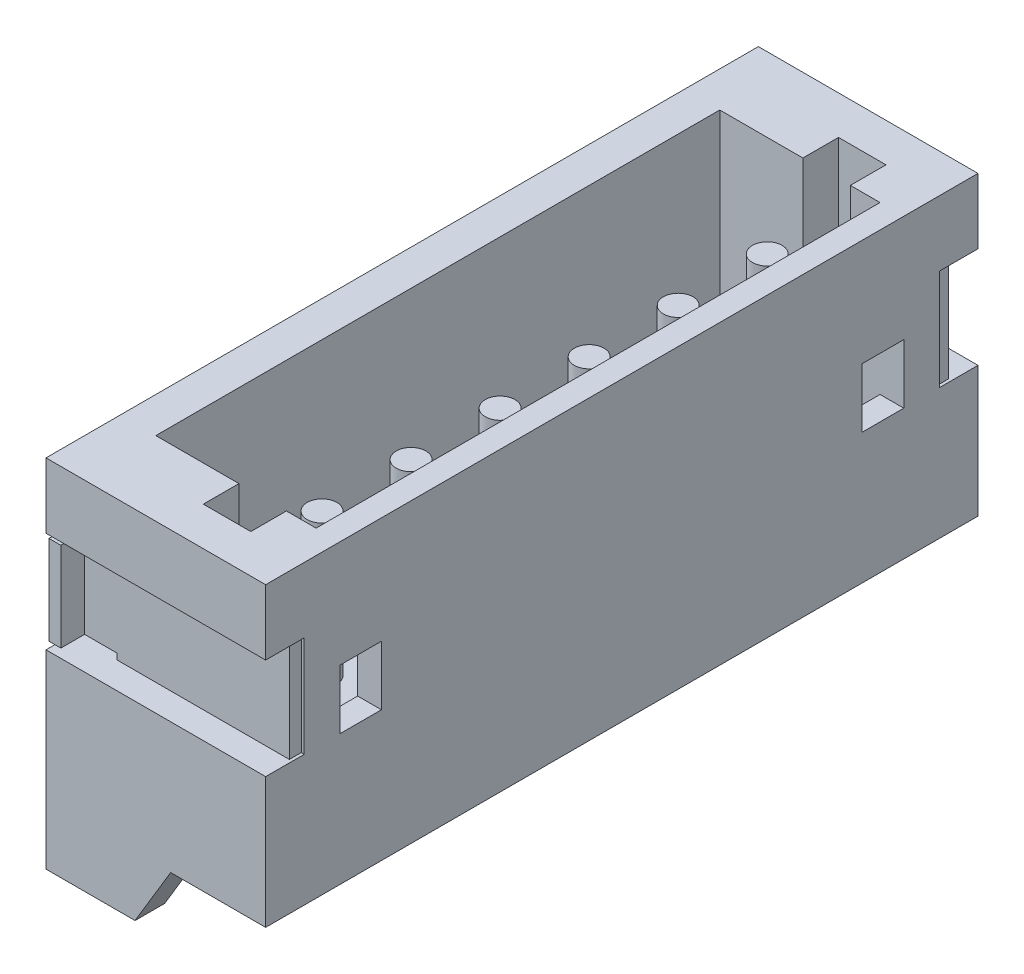
from build123d import *

# Parameters (mm, degrees)
BOSS_EXTRUDE1_START       = -0.6
BOSS_EXTRUDE1_DEPTH       = 3.3
BOSS_EXTRUDE1_2_OUTLINE_W = 9.5
BOSS_EXTRUDE1_2_OUTLINE_H = 2.8
BOSS_EXTRUDE1_2_DEPTH     = 0.6
BOSS_EXTRUDE1_3_OUTLINE_R = 0.25
BOSS_EXTRUDE1_3_ANGLE     = 48.590678
SKETCH2_W                 = 12
SKETCH2_H                 = 5
SKETCH2_W_2               = 0.7
SKETCH2_H_2               = 1
BOSS_EXTRUDE2_DEPTH       = 0.4
SKETCH3_W                 = 2.7
SKETCH3_H                 = 9.5
CUT_EXTRUDE1_DEPTH        = 0.6
SKETCH4_W                 = 0.45
SKETCH4_H                 = 1.7
CUT_EXTRUDE2_DEPTH        = 15.612665805
CUT_EXTRUDE3_REACH        = 50.095
SKETCH6_W                 = 0.05
SKETCH6_H                 = 1.7
SKETCH7_W                 = 0.45
SKETCH7_H                 = 1.7
CUT_EXTRUDE4_DEPTH        = 15.612665805
CUT_EXTRUDE5_REACH        = 50.095
SKETCH9_W                 = 0.05
SKETCH9_H                 = 1.7
CUT_EXTRUDE6_REACH        = 50.095
SKETCH11_W                = 0.75
SKETCH11_H                = 0.1
SKETCH12_W                = 0.2
SKETCH12_H                = 1.5
BOSS_EXTRUDE3_DEPTH       = 0.4
CUT_EXTRUDE7_REACH        = 50.095
SKETCH14_W                = 0.75
SKETCH14_H                = 0.1
CUT_EXTRUDE8_REACH        = 50.095
SKETCH16_W                = 0.75
SKETCH16_H                = 0.1
SKETCH17_W                = 0.2
SKETCH17_H                = 1.5
BOSS_EXTRUDE4_DEPTH       = 0.4
CUT_EXTRUDE9_REACH        = 50.095
SKETCH19_W                = 0.75
SKETCH19_H                = 0.1
BOSS_EXTRUDE5_DEPTH       = 9.5
SKETCH21_W                = 0.8
SKETCH21_H                = 0.6
CUT_EXTRUDE10_DEPTH       = 1.8
SKETCH22_W                = 0.8
SKETCH22_H                = 0.6
CUT_EXTRUDE11_DEPTH       = 1.8
SKETCH23_R                = 0.25
BOSS_EXTRUDE6_DEPTH       = 1.35
SKETCH24_R                = 0.25
BOSS_EXTRUDE7_DEPTH       = 1.35
SKETCH25_R                = 0.25
BOSS_EXTRUDE8_DEPTH       = 1.35
SKETCH26_R                = 0.25
BOSS_EXTRUDE9_DEPTH       = 1.35
SKETCH27_R                = 0.25
BOSS_EXTRUDE10_DEPTH      = 1.35
BOSS_EXTRUDE11_DEPTH      = 0.5
BOSS_EXTRUDE12_DEPTH      = 0.5
SKETCH30_R                = 0.25
BOSS_EXTRUDE13_DEPTH      = 1.35
SKETCH31_W                = 0.25
SKETCH31_H                = 2.4
SKETCH32_W                = 0.25
SKETCH32_H                = 2.4
SKETCH33_W                = 0.25
SKETCH33_H                = 2.4
SKETCH34_W                = 0.25
SKETCH34_H                = 2.4
SKETCH35_W                = 0.25
SKETCH35_H                = 2.4
SKETCH36_W                = 0.25
SKETCH36_H                = 2.4


with BuildPart() as part:
    # Boss-Extrude1: read off the stored shape, not the designer's step
    # Boss-Extrude1 outline → Boss-Extrude1 (new body)
    with BuildSketch(Plane(origin=(41.85, 0, 0), x_dir=(0, 0, -1), z_dir=(1, 0, 0)).offset(BOSS_EXTRUDE1_START)):
        Polygon((-4.75, 12.8), (-6, 12.8), (-6, 7.8), (6, 7.8), (6, 12.8), (4.75, 12.8), (4.75, 10), (-4.75, 10), align=None)
    extrude(amount=BOSS_EXTRUDE1_DEPTH)

    # Boss-Extrude1 2 outline → Boss-Extrude1 2 (add)
    with BuildSketch(Plane(origin=(41.85, 0, 0), x_dir=(0, 0, -1), z_dir=(1, 0, 0)).offset(BOSS_EXTRUDE1_START)):
        with Locations((0, 11.4)):
            Rectangle(BOSS_EXTRUDE1_2_OUTLINE_W, BOSS_EXTRUDE1_2_OUTLINE_H)
    extrude(amount=BOSS_EXTRUDE1_2_DEPTH)

    # Boss-Extrude1 3 outline → Boss-Extrude1 3 (revolve)
    with BuildSketch(Plane(origin=(41.95, 7.65, 0), x_dir=(-0.6614338946121362, 0.7500034686974597, 0), z_dir=(0.7500034686974597, 0.6614338946121362, 0))):
        with Locations((0.45, 2.25)):
            Circle(BOSS_EXTRUDE1_3_OUTLINE_R)
        with Locations((0.45, -2.25)):
            Circle(BOSS_EXTRUDE1_3_OUTLINE_R)
        with Locations((0.45, -0.75)):
            Circle(BOSS_EXTRUDE1_3_OUTLINE_R)
        with Locations((0.45, 0.75)):
            Circle(BOSS_EXTRUDE1_3_OUTLINE_R)
        with Locations((0.45, 3.75)):
            Circle(BOSS_EXTRUDE1_3_OUTLINE_R)
        with Locations((0.45, -3.75)):
            Circle(BOSS_EXTRUDE1_3_OUTLINE_R)
    revolve(axis=Axis((41.95, 7.65, 0), (0, 0, 1)), revolution_arc=BOSS_EXTRUDE1_3_ANGLE)

    # Sketch2 → Boss-Extrude2 (add)
    with BuildSketch(Plane(origin=(44.55, 0, 0), x_dir=(0, 0, -1), z_dir=(1, 0, 0))):
        with Locations((0, 10.3)):
            Rectangle(SKETCH2_W, SKETCH2_H)
        with Locations((4.4, 10.5)):
            Rectangle(SKETCH2_W_2, SKETCH2_H_2, mode=Mode.SUBTRACT)
        with Locations((-4.4, 10.5)):
            Rectangle(SKETCH2_W_2, SKETCH2_H_2, mode=Mode.SUBTRACT)
    extrude(amount=BOSS_EXTRUDE2_DEPTH)

    # Sketch3 → Cut-Extrude1 (cut)
    with BuildSketch(Plane(origin=(0, 10, 0), x_dir=(-1, 0, 0), z_dir=(0, 1, 0))):
        with Locations((-43.2, 0)):
            Rectangle(SKETCH3_W, SKETCH3_H)
    extrude(amount=-CUT_EXTRUDE1_DEPTH, mode=Mode.SUBTRACT)

    # Sketch4 → Cut-Extrude2 (cut, through all)
    with BuildSketch(Plane(origin=(44.95, 0, 0), x_dir=(0, 0, -1), z_dir=(1, 0, 0))):
        with Locations((-5.775, 10.85)):
            Rectangle(SKETCH4_W, SKETCH4_H)
    extrude(amount=-CUT_EXTRUDE2_DEPTH, mode=Mode.SUBTRACT)

    # Sketch6 → Cut-Extrude3 (cut, up to next)
    with BuildSketch(Plane(origin=(0, 0, 5.35), x_dir=(-1, 0, 0), z_dir=(0, 0, -1)), mode=Mode.PRIVATE) as cut_extrude3_sk1:
        with Locations((-44.925, 10.85)):
            Rectangle(SKETCH6_W, SKETCH6_H)
    cut_extrude3_tool1 = extrude(cut_extrude3_sk1.sketch, amount=-CUT_EXTRUDE3_REACH, mode=Mode.PRIVATE) & part.part
    add(cut_extrude3_tool1.solids().sort_by_distance((44.925, 10.85, 5.35))[0], mode=Mode.SUBTRACT)

    # Sketch7 → Cut-Extrude4 (cut, through all)
    with BuildSketch(Plane(origin=(44.95, 0, 0), x_dir=(0, 0, -1), z_dir=(1, 0, 0))):
        with Locations((5.775, 10.85)):
            Rectangle(SKETCH7_W, SKETCH7_H)
    extrude(amount=-CUT_EXTRUDE4_DEPTH, mode=Mode.SUBTRACT)

    # Sketch9 → Cut-Extrude5 (cut, up to next)
    with BuildSketch(Plane.XY.offset(-5.35), mode=Mode.PRIVATE) as cut_extrude5_sk1:
        with Locations((44.925, 10.85)):
            Rectangle(SKETCH9_W, SKETCH9_H)
    cut_extrude5_tool1 = extrude(cut_extrude5_sk1.sketch, amount=-CUT_EXTRUDE5_REACH, mode=Mode.PRIVATE) & part.part
    add(cut_extrude5_tool1.solids().sort_by_distance((44.925, 10.85, -5.35))[0], mode=Mode.SUBTRACT)

    # Sketch11 → Cut-Extrude6 (cut, up to next)
    with BuildSketch(Plane.XY.offset(-5.35), mode=Mode.PRIVATE) as cut_extrude6_sk1:
        with Locations((41.625, 10.05)):
            Rectangle(SKETCH11_W, SKETCH11_H)
    cut_extrude6_tool1 = extrude(cut_extrude6_sk1.sketch, amount=-CUT_EXTRUDE6_REACH, mode=Mode.PRIVATE) & part.part
    add(cut_extrude6_tool1.solids().sort_by_distance((41.625, 10.05, -5.35))[0], mode=Mode.SUBTRACT)

    # Sketch12 → Boss-Extrude3 (add)
    with BuildSketch(Plane(origin=(0, 0, -5.55), x_dir=(-1, 0, 0), z_dir=(0, 0, -1))):
        with Locations((-41.35, 10.85)):
            Rectangle(SKETCH12_W, SKETCH12_H)
    extrude(amount=BOSS_EXTRUDE3_DEPTH)

    # Sketch14 → Cut-Extrude7 (cut, up to next)
    with BuildSketch(Plane.XY.offset(-5.35), mode=Mode.PRIVATE) as cut_extrude7_sk1:
        with Locations((41.625, 11.65)):
            Rectangle(SKETCH14_W, SKETCH14_H)
    cut_extrude7_tool1 = extrude(cut_extrude7_sk1.sketch, amount=-CUT_EXTRUDE7_REACH, mode=Mode.PRIVATE) & part.part
    add(cut_extrude7_tool1.solids().sort_by_distance((41.625, 11.65, -5.35))[0], mode=Mode.SUBTRACT)

    # Sketch16 → Cut-Extrude8 (cut, up to next)
    with BuildSketch(Plane(origin=(0, 0, 5.35), x_dir=(-1, 0, 0), z_dir=(0, 0, -1)), mode=Mode.PRIVATE) as cut_extrude8_sk1:
        with Locations((-41.625, 11.65)):
            Rectangle(SKETCH16_W, SKETCH16_H)
    cut_extrude8_tool1 = extrude(cut_extrude8_sk1.sketch, amount=-CUT_EXTRUDE8_REACH, mode=Mode.PRIVATE) & part.part
    add(cut_extrude8_tool1.solids().sort_by_distance((41.625, 11.65, 5.35))[0], mode=Mode.SUBTRACT)

    # Sketch17 → Boss-Extrude4 (add)
    with BuildSketch(Plane.XY.offset(5.55)):
        with Locations((41.35, 10.85)):
            Rectangle(SKETCH17_W, SKETCH17_H)
    extrude(amount=BOSS_EXTRUDE4_DEPTH)

    # Sketch19 → Cut-Extrude9 (cut, up to next)
    with BuildSketch(Plane(origin=(0, 0, 5.35), x_dir=(-1, 0, 0), z_dir=(0, 0, -1)), mode=Mode.PRIVATE) as cut_extrude9_sk1:
        with Locations((-41.625, 10.05)):
            Rectangle(SKETCH19_W, SKETCH19_H)
    cut_extrude9_tool1 = extrude(cut_extrude9_sk1.sketch, amount=-CUT_EXTRUDE9_REACH, mode=Mode.PRIVATE) & part.part
    add(cut_extrude9_tool1.solids().sort_by_distance((41.625, 10.05, 5.35))[0], mode=Mode.SUBTRACT)

    # Sketch20 → Boss-Extrude5 (add)
    with BuildSketch(Plane(origin=(0, 0, 4.75), x_dir=(-1, 0, 0), z_dir=(0, 0, -1))):
        Polygon((-42.9, 9.4), (-44.55, 9.4), (-44.55, 9.7), (-43.2, 9.7), align=None)
    extrude(amount=BOSS_EXTRUDE5_DEPTH)

    # Sketch21 → Cut-Extrude10 (cut)
    with BuildSketch(Plane(origin=(0, 12.8, 0), x_dir=(-1, 0, 0), z_dir=(0, 1, 0))):
        with Locations((-43.65, -5.05)):
            Rectangle(SKETCH21_W, SKETCH21_H)
    extrude(amount=-CUT_EXTRUDE10_DEPTH, mode=Mode.SUBTRACT)

    # Sketch22 → Cut-Extrude11 (cut)
    with BuildSketch(Plane(origin=(0, 12.8, 0), x_dir=(-1, 0, 0), z_dir=(0, 1, 0))):
        with Locations((-43.65, 5.05)):
            Rectangle(SKETCH22_W, SKETCH22_H)
    extrude(amount=-CUT_EXTRUDE11_DEPTH, mode=Mode.SUBTRACT)

    # Sketch23 → Boss-Extrude6 (add)
    with BuildSketch(Plane.XZ.offset(-7.65)):
        with Locations(Location((41.5, 2.25, 0), (0, 0, 90))):
            Circle(SKETCH23_R)
    extrude(amount=BOSS_EXTRUDE6_DEPTH)

    # Sketch24 → Boss-Extrude7 (add)
    with BuildSketch(Plane.XZ.offset(-7.65)):
        with Locations(Location((41.5, -0.75, 0), (0, 0, 90))):
            Circle(SKETCH24_R)
    extrude(amount=BOSS_EXTRUDE7_DEPTH)

    # Sketch25 → Boss-Extrude8 (add)
    with BuildSketch(Plane.XZ.offset(-7.65)):
        with Locations(Location((41.5, -3.75, 0), (0, 0, 90))):
            Circle(SKETCH25_R)
    extrude(amount=BOSS_EXTRUDE8_DEPTH)

    # Sketch26 → Boss-Extrude9 (add)
    with BuildSketch(Plane.XZ.offset(-7.65)):
        with Locations(Location((41.5, -2.25, 0), (0, 0, 90))):
            Circle(SKETCH26_R)
    extrude(amount=BOSS_EXTRUDE9_DEPTH)

    # Sketch27 → Boss-Extrude10 (add)
    with BuildSketch(Plane.XZ.offset(-7.65)):
        with Locations(Location((41.5, 0.75, 0), (0, 0, 90))):
            Circle(SKETCH27_R)
    extrude(amount=BOSS_EXTRUDE10_DEPTH)

    # Sketch28 → Boss-Extrude11 (add)
    with BuildSketch(Plane.XY.offset(6)):
        Polygon((43.35, 7.8), (41.25, 7.8), (41.25, 6.8), (42.75, 6.8), align=None)
    extrude(amount=-BOSS_EXTRUDE11_DEPTH)

    # Sketch29 → Boss-Extrude12 (add)
    with BuildSketch(Plane(origin=(0, 0, -6), x_dir=(-1, 0, 0), z_dir=(0, 0, -1))):
        Polygon((-41.25, 6.8), (-41.25, 7.8), (-43.35, 7.8), (-42.75, 6.8), align=None)
    extrude(amount=-BOSS_EXTRUDE12_DEPTH)

    # Sketch30 → Boss-Extrude13 (add)
    with BuildSketch(Plane.XZ.offset(-7.65)):
        with Locations(Location((41.5, 3.75, 0), (0, 0, 90))):
            Circle(SKETCH30_R)
    extrude(amount=BOSS_EXTRUDE13_DEPTH)

    # Sketch31 → Revolve1 (revolve)
    with BuildSketch(Plane.XY.offset(3.75)):
        with Locations((43.775, 10.9)):
            Rectangle(SKETCH31_W, SKETCH31_H)
    revolve(axis=Axis((43.65, 12.1, 3.75), (0, -1, 0)))

    # Sketch32 → Revolve2 (revolve)
    with BuildSketch(Plane.XY.offset(0.75)):
        with Locations((43.775, 10.9)):
            Rectangle(SKETCH32_W, SKETCH32_H)
    revolve(axis=Axis((43.65, 12.1, 0.75), (0, -1, 0)))

    # Sketch33 → Revolve3 (revolve)
    with BuildSketch(Plane.XY.offset(-2.25)):
        with Locations((43.775, 10.9)):
            Rectangle(SKETCH33_W, SKETCH33_H)
    revolve(axis=Axis((43.65, 12.1, -2.25), (0, -1, 0)))

    # Sketch34 → Revolve4 (revolve)
    with BuildSketch(Plane.XY.offset(-3.75)):
        with Locations((43.775, 10.9)):
            Rectangle(SKETCH34_W, SKETCH34_H)
    revolve(axis=Axis((43.65, 12.1, -3.75), (0, -1, 0)))

    # Sketch35 → Revolve5 (revolve)
    with BuildSketch(Plane.XY.offset(-0.75)):
        with Locations((43.775, 10.9)):
            Rectangle(SKETCH35_W, SKETCH35_H)
    revolve(axis=Axis((43.65, 12.1, -0.75), (0, -1, 0)))

    # Sketch36 → Revolve6 (revolve)
    with BuildSketch(Plane.XY.offset(2.25)):
        with Locations((43.775, 10.9)):
            Rectangle(SKETCH36_W, SKETCH36_H)
    revolve(axis=Axis((43.65, 12.1, 2.25), (0, -1, 0)))


solid = part.part
